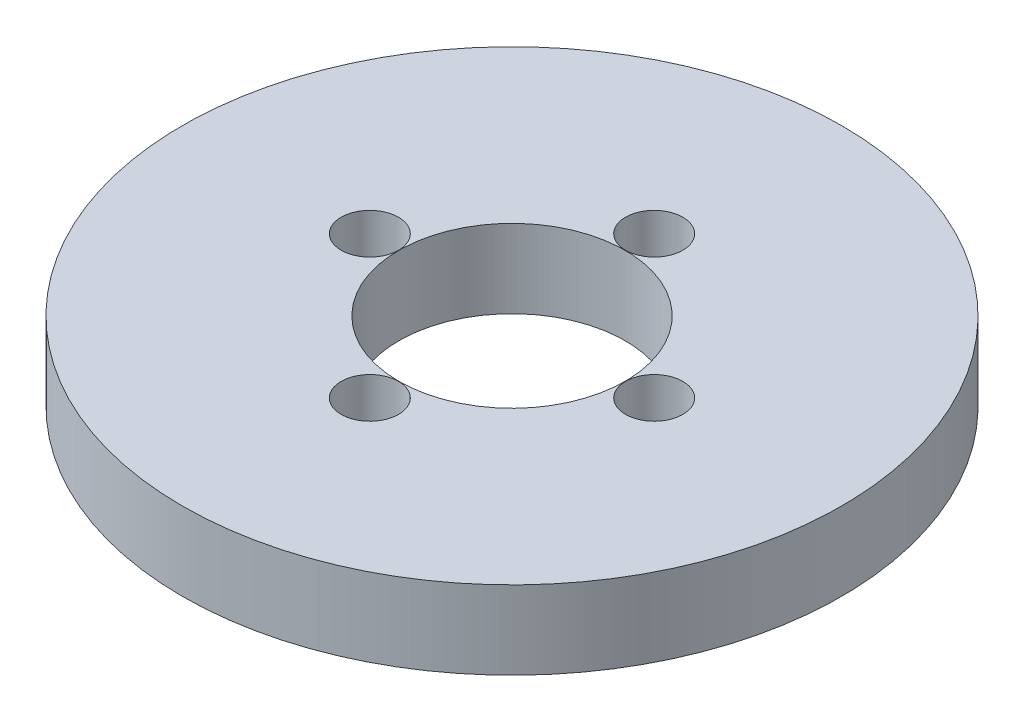
from build123d import *

# Parameters (mm, degrees)
SKETCH1_R           = 80
BOSS_EXTRUDE1_DEPTH = 19
SKETCH2_R           = 27.5
CUT_EXTRUDE1_DEPTH  = 115.721401665
SKETCH3_R           = 6.954316627
CUT_EXTRUDE2_DEPTH  = 13.14529082
CIRPATTERN1_COUNT   = 4


with BuildPart() as part:
    # Sketch1 → Boss-Extrude1 (new body)
    with BuildSketch(Plane(origin=(0, 0, 0), x_dir=(1, 0, 0), z_dir=(0, 1, 0))):
        Circle(SKETCH1_R)
    extrude(amount=BOSS_EXTRUDE1_DEPTH)

    # Sketch2 → Cut-Extrude1 (cut, through all)
    with BuildSketch(Plane(origin=(0, 0, 0), x_dir=(1, 0, 0), z_dir=(0, 1, 0))):
        Circle(SKETCH2_R)
    extrude(amount=CUT_EXTRUDE1_DEPTH, mode=Mode.SUBTRACT)

    # Sketch3 → Cut-Extrude2 (cut)
    with BuildSketch(Plane(origin=(0, 19, 0), x_dir=(1, 0, 0), z_dir=(0, 1, 0))):
        with Locations((-34.514881057, 0)):
            Circle(SKETCH3_R)
    cut_extrude2 = extrude(amount=-CUT_EXTRUDE2_DEPTH, mode=Mode.SUBTRACT)

    # CirPattern1: Cut-Extrude2 ×4 about axis
    cirpattern1_axis = Axis((0, 0, 0), (0, 1, 0))
    for i in range(1, CIRPATTERN1_COUNT):
        add(cut_extrude2.rotate(cirpattern1_axis, i * 360 / CIRPATTERN1_COUNT), mode=Mode.SUBTRACT)


solid = part.part
